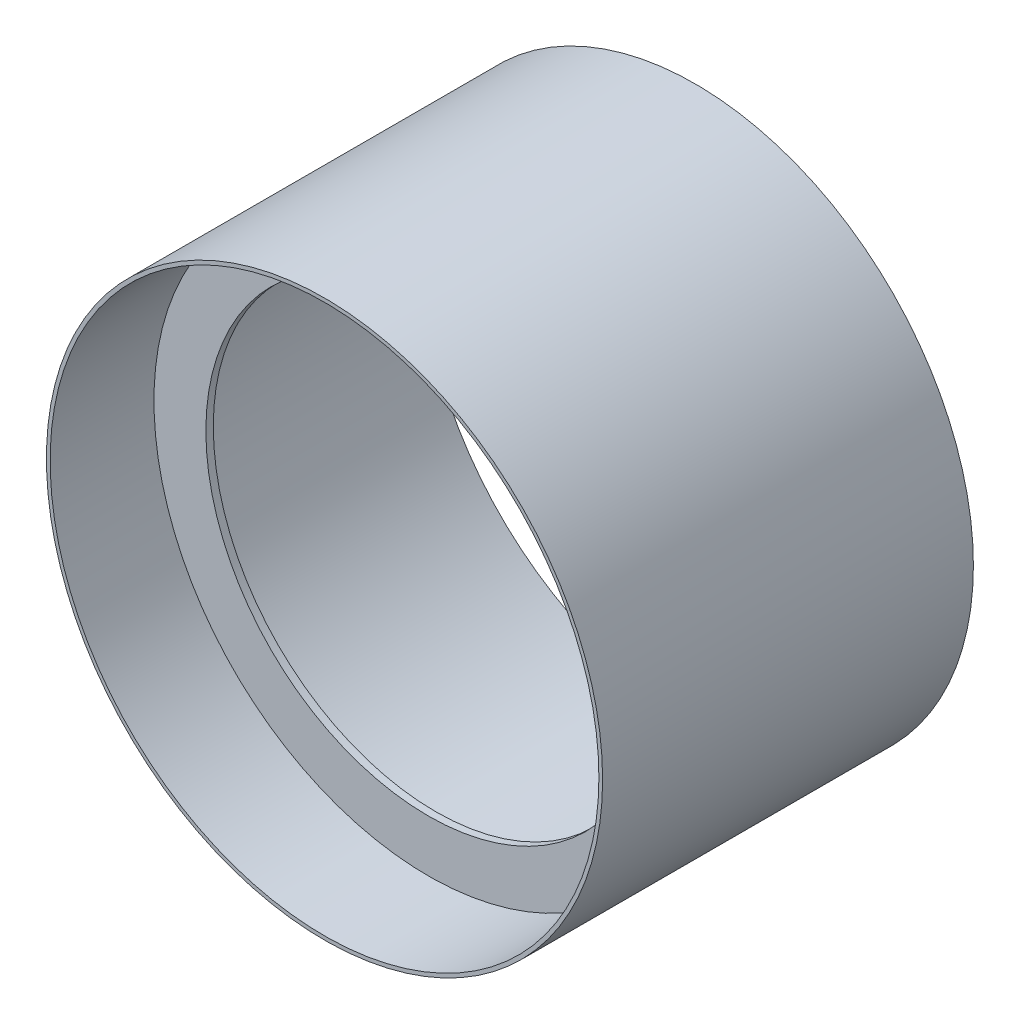
from build123d import *

# Parameters (mm, degrees)
SKETCH_1_R      = 75
EXTRUDE_1_DEPTH = 100
SHELL_1_T       = -1
SKETCH_2_R      = 75
SKETCH_2_R_2    = 60
EXTRUDE_2_DEPTH = 2


with BuildPart() as part:
    # 草图1 → 凸台-拉伸1 (new body)
    with BuildSketch(Plane.XY):
        Circle(SKETCH_1_R)
    extrude(amount=EXTRUDE_1_DEPTH)

    # 抽壳1
    shell_1_openings = [part.faces().sort_by_distance(p)[0] for p in [
        (0, 0, 0),
        (0, 0, 100),
    ]]
    offset(amount=SHELL_1_T, openings=shell_1_openings, kind=Kind.INTERSECTION)

    # 草图2 → 凸台-拉伸2 (add)
    with BuildSketch(Plane.XY.offset(70)):
        Circle(SKETCH_2_R)
        Circle(SKETCH_2_R_2, mode=Mode.SUBTRACT)
    extrude(amount=EXTRUDE_2_DEPTH)


solid = part.part
